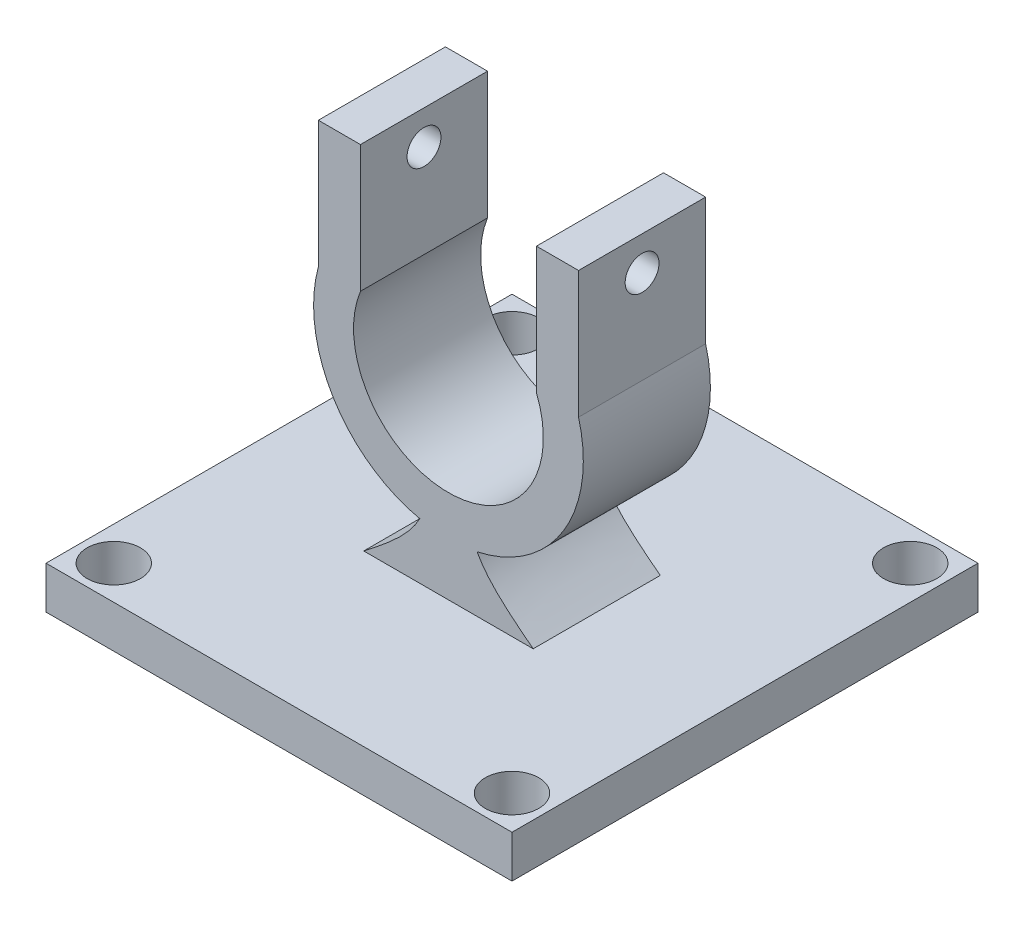
from build123d import *

# Parameters (mm, degrees)
SKETCH1_W           = 55
SKETCH1_H           = 55
BOSS_EXTRUDE1_DEPTH = 5
LOFT1_START         = -7.5
LOFT1_DEPTH         = 15
SKETCH7_R           = 3.15
CUT_EXTRUDE1_DEPTH  = 42.683330037
BOSS_EXTRUDE2_DEPTH = 15
SKETCH10_R          = 2
CUT_EXTRUDE2_DEPTH  = 69.855497331


# Read off the part's stored shape, not the designer's step: Loft1
with BuildPart() as part:
    # Sketch1 → Boss-Extrude1 (new body)
    with BuildSketch(Plane(origin=(0, 0, 0), x_dir=(1, 0, 0), z_dir=(0, 1, 0))):
        Rectangle(SKETCH1_W, SKETCH1_H)
    extrude(amount=BOSS_EXTRUDE1_DEPTH)

    # Loft1 outline → Loft1 (add)
    with BuildSketch(Plane.XY.offset(LOFT1_START)):
        with BuildLine():
            add(Edge.make_bspline(
                [(2.5, 15), (2.5, 10.833333333), (6.25, 7.916666667), (10, 5)],
                knots=[0, 0, 0, 0, 1, 1, 1, 1], degree=3))
            Line((2.5, 15), (-2.5, 15))
            add(Edge.make_bspline(
                [(-2.5, 15), (-2.5, 10.833333333), (-6.25, 7.916666667), (-10, 5)],
                knots=[0, 0, 0, 0, 1, 1, 1, 1], degree=3))
            Line((-10, 5), (10, 5))
        make_face()
    extrude(amount=LOFT1_DEPTH)

    # Sketch7 → Cut-Extrude1 (cut, through all)
    with BuildSketch(Plane(origin=(0, 0, 0), x_dir=(-1, 0, 0), z_dir=(0, -1, 0))):
        with Locations(Location((23.5, -23.5, 0), (0, 0, 90))):
            Circle(SKETCH7_R)
        with Locations(Location((-23.5, -23.5, 0), (0, 0, 90))):
            Circle(SKETCH7_R)
        with Locations(Location((-23.5, 23.5, 0), (0, 0, 90))):
            Circle(SKETCH7_R)
        with Locations(Location((23.5, 23.5, 0), (0, 0, 90))):
            Circle(SKETCH7_R)
    extrude(amount=-CUT_EXTRUDE1_DEPTH, mode=Mode.SUBTRACT)

    # Sketch8 → Boss-Extrude2 (add)
    with BuildSketch(Plane(origin=(0, 0, -7.5), x_dir=(-1, 0, 0), z_dir=(0, 0, -1))):
        with BuildLine():
            Line((-10.386332084, 31.349499896), (-10.386332084, 46.349499896))
            Line((-10.386332084, 46.349499896), (-15.355027277, 46.349499896))
            Line((-15.355027277, 46.349499896), (-15.355027277, 31.349499896))
            ThreePointArc((-15.355027277, 31.349499896), (0, 11.24185629), (15.355027277, 31.349499896))
            Line((15.355027277, 31.349499896), (15.355027277, 46.349499896))
            Line((15.355027277, 46.349499896), (10.386332084, 46.349499896))
            Line((10.386332084, 46.349499896), (10.386332084, 31.349499896))
            ThreePointArc((10.386332084, 31.349499896), (10.968139681, 29.425682042), (11.196737575, 27.428855004))
            ThreePointArc((11.196737575, 27.428855004), (11.085843409, 25.563528692), (10.666364419, 23.742601142))
            ThreePointArc((10.666364419, 23.742601142), (0, 15.958544655), (-10.666364419, 23.742601142))
            ThreePointArc((-10.666364419, 23.742601142), (-11.048273693, 25.321250886), (-11.197838961, 26.93853872))
            ThreePointArc((-11.197838961, 26.93853872), (-11.015137518, 29.185055314), (-10.386332084, 31.349499896))
        make_face()
    extrude(amount=-BOSS_EXTRUDE2_DEPTH)

    # Sketch10 → Cut-Extrude2 (cut, through all)
    with BuildSketch(Plane(origin=(15.355027277, 0, 0), x_dir=(0, 0, -1), z_dir=(1, 0, 0))):
        with Locations(Location((0, 42.349499896, 0), (0, 0, 180))):
            Circle(SKETCH10_R)
    extrude(amount=-CUT_EXTRUDE2_DEPTH, mode=Mode.SUBTRACT)


solid = part.part
